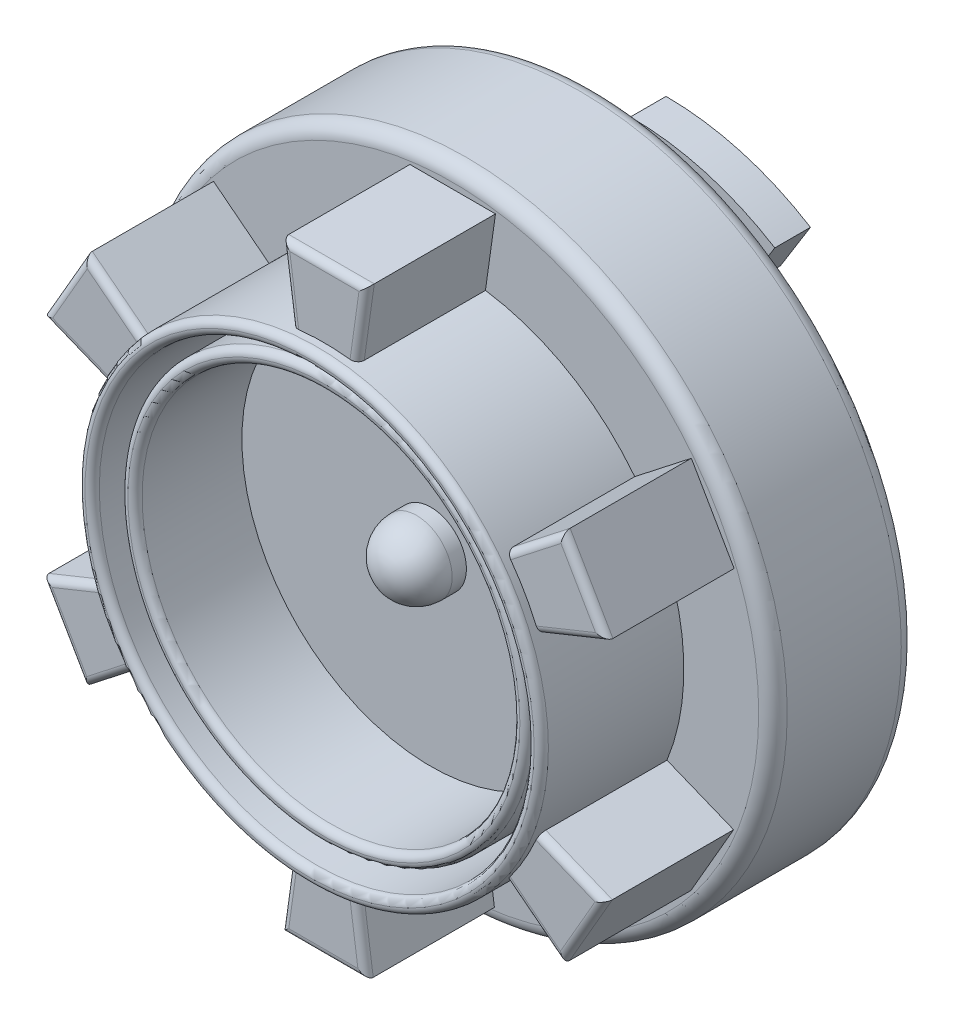
from build123d import *

# Parameters (mm, degrees)
SKETCH1_R           = 41.275
BOSS_EXTRUDE1_DEPTH = 25.4
SKETCH2_R           = 36.068
CUT_EXTRUDE1_DEPTH  = 25.4
SKETCH3_R           = 57.15
BOSS_EXTRUDE2_DEPTH = 25.4
SKETCH4_R           = 29.21
CUT_EXTRUDE2_DEPTH  = 96.461432003
CUT_EXTRUDE4_DEPTH  = 22.86
CUT_EXTRUDE5_DEPTH  = 20.32
BOSS_EXTRUDE3_DEPTH = 6.35
BOSS_EXTRUDE4_DEPTH = 6.35
BOSS_EXTRUDE5_DEPTH = 6.35
BOSS_EXTRUDE6_DEPTH = 6.35
CUT_EXTRUDE6_DEPTH  = 22.86
CUT_EXTRUDE7_DEPTH  = 20.32
SKETCH15_R          = 34.29
SKETCH15_R_2        = 30.48
CUT_EXTRUDE8_DEPTH  = 12.7
FILLET1_R           = 2.54
BOSS_EXTRUDE7_START = -25.4
SKETCH16_R          = 41.275
BOSS_EXTRUDE7_DEPTH = 25.4
SKETCH17_R          = 38.735
SKETCH17_R_2        = 36.195
CUT_EXTRUDE9_DEPTH  = 25.4
SKETCH18_R          = 33.655
SKETCH18_R_2        = 6.35
CUT_EXTRUDE10_DEPTH = 21.59
SKETCH19_R          = 6.35
CUT_EXTRUDE11_DEPTH = 12.7
SKETCH20_R          = 36.195
SKETCH20_R_2        = 33.655
CUT_EXTRUDE12_DEPTH = 2.54
FILLET2_R           = 6.35
FILLET3_R           = 1.27
FILLET4_R           = 1.27
BOSS_EXTRUDE8_DEPTH = 22.86
FILLET5_R           = 1.27
FILLET6_R           = 2.54


with BuildPart() as part:
    # Sketch1 → Boss-Extrude1 (new body)
    with BuildSketch(Plane.XY):
        Circle(SKETCH1_R)
    extrude(amount=BOSS_EXTRUDE1_DEPTH)

    # Sketch2 → Cut-Extrude1 (cut)
    with BuildSketch(Plane.XY.offset(25.4)):
        Circle(SKETCH2_R)
    extrude(amount=-CUT_EXTRUDE1_DEPTH, mode=Mode.SUBTRACT)

    # Sketch3 → Boss-Extrude2 (add)
    with BuildSketch(Plane(origin=(0, 0, 0), x_dir=(-1, 0, 0), z_dir=(0, 0, -1))):
        Circle(SKETCH3_R)
    extrude(amount=BOSS_EXTRUDE2_DEPTH)

    # Sketch4 → Cut-Extrude2 (cut, through all)
    with BuildSketch(Plane(origin=(0, 0, -25.4), x_dir=(-1, 0, 0), z_dir=(0, 0, -1))):
        Circle(SKETCH4_R)
    extrude(amount=-CUT_EXTRUDE2_DEPTH, mode=Mode.SUBTRACT)

    # Sketch6 → Cut-Extrude4 (cut)
    with BuildSketch(Plane(origin=(0, 0, -25.4), x_dir=(-1, 0, 0), z_dir=(0, 0, -1))):
        with BuildLine():
            Line((18.506279238, -30.364967129), (24.454726136, -40.125135135))
            ThreePointArc((24.454726136, -40.125135135), (46.842589674, -3.719125253), (30.48, 35.763524714))
            ThreePointArc((30.48, 35.763524714), (28.349648711, 38.283083694), (27.139008157, 41.35243599))
            ThreePointArc((27.139008157, 41.35243599), (26.51640571, 42.835799248), (25.4, 43.994090512))
            ThreePointArc((25.4, 43.994090512), (13.148007491, 49.069031975), (0, 50.8))
            Line((0, 50.8), (0, 35.56))
            ThreePointArc((0, 35.56), (34.23661659, 9.610810811), (18.506279238, -30.364967129))
        make_face()
    extrude(amount=-CUT_EXTRUDE4_DEPTH, mode=Mode.SUBTRACT)

    # Sketch8 → Cut-Extrude5 (cut)
    with BuildSketch(Plane(origin=(0, 0, -22.86), x_dir=(-1, 0, 0), z_dir=(0, 0, -1))):
        with BuildLine():
            Line((26.437541769, -43.37852447), (24.454726136, -40.125135135))
            ThreePointArc((24.454726136, -40.125135135), (46.842589674, -3.719125253), (30.48, 35.763524714))
            ThreePointArc((30.48, 35.763524714), (28.349648711, 38.283083694), (27.139008157, 41.35243599))
            ThreePointArc((27.139008157, 41.35243599), (26.51640571, 42.835799248), (25.4, 43.994090512))
            ThreePointArc((25.4, 43.994090512), (50.796418637, 0.6032028), (26.437541769, -43.37852447))
        make_face()
    extrude(amount=-CUT_EXTRUDE5_DEPTH, mode=Mode.SUBTRACT)

    # Sketch9 → Boss-Extrude3 (add)
    with BuildSketch(Plane(origin=(0, 0, -25.4), x_dir=(-1, 0, 0), z_dir=(0, 0, -1))):
        with BuildLine():
            Line((0, 44.45), (0, 38.608))
            ThreePointArc((0, 38.608), (-10.589622857, 37.127315439), (-20.36698447, 32.798835461))
            Line((-20.36698447, 32.798835461), (-23.448830804, 37.761817143))
            ThreePointArc((-23.448830804, 37.761817143), (-12.192, 42.745264486), (0, 44.45))
        make_face()
    extrude(amount=BOSS_EXTRUDE3_DEPTH)

    # Sketch10 → Boss-Extrude4 (add)
    with BuildSketch(Plane(origin=(0, 0, -31.75), x_dir=(-1, 0, 0), z_dir=(0, 0, -1))):
        with BuildLine():
            Line((-20.36698447, 32.798835461), (-25.726717225, 41.430107951))
            ThreePointArc((-25.726717225, 41.430107951), (-13.376365714, 46.897661608), (0, 48.768))
            Line((0, 48.768), (0, 38.608))
            ThreePointArc((0, 38.608), (-10.589622857, 37.127315439), (-20.36698447, 32.798835461))
        make_face()
    extrude(amount=BOSS_EXTRUDE4_DEPTH)

    # Sketch11 → Boss-Extrude5 (add)
    with BuildSketch(Plane(origin=(0, 0, -25.4), x_dir=(-1, 0, 0), z_dir=(0, 0, -1))):
        with BuildLine():
            Line((0, -46.228), (0, -38.608))
            ThreePointArc((0, -38.608), (10.434594595, -37.171183727), (20.092531744, -32.967678598))
            Line((20.092531744, -32.967678598), (24.058163009, -39.474457268))
            ThreePointArc((24.058163009, -39.474457268), (12.494054054, -44.507601568), (0, -46.228))
        make_face()
    extrude(amount=BOSS_EXTRUDE5_DEPTH)

    # Sketch12 → Boss-Extrude6 (add)
    with BuildSketch(Plane(origin=(0, 0, -31.75), x_dir=(-1, 0, 0), z_dir=(0, 0, -1))):
        with BuildLine():
            Line((0, -38.608), (0, -48.768))
            ThreePointArc((0, -48.768), (13.180540541, -46.953074181), (25.380040098, -41.643383492))
            Line((25.380040098, -41.643383492), (20.092531744, -32.967678598))
            ThreePointArc((20.092531744, -32.967678598), (10.434594595, -37.171183727), (0, -38.608))
        make_face()
    extrude(amount=BOSS_EXTRUDE6_DEPTH)

    # Sketch13 → Cut-Extrude6 (cut)
    with BuildSketch(Plane(origin=(0, 0, -25.4), x_dir=(-1, 0, 0), z_dir=(0, 0, -1))):
        with BuildLine():
            Line((0, -35.56), (0, -50.8))
            ThreePointArc((0, -50.8), (-13.148007491, -49.069031975), (-25.4, -43.994090512))
            ThreePointArc((-25.4, -43.994090512), (-27.380071612, -41.913162133), (-27.914964156, -39.090957945))
            ThreePointArc((-27.914964156, -39.090957945), (-29.023609665, -37.293207394), (-30.48, -35.763524714))
            ThreePointArc((-30.48, -35.763524714), (-46.857702082, 3.52361399), (-24.788763993, 39.919635265))
            Line((-24.788763993, 39.919635265), (-18.759064643, 30.209453714))
            ThreePointArc((-18.759064643, 30.209453714), (-34.196211589, -9.7536), (0, -35.56))
        make_face()
    extrude(amount=-CUT_EXTRUDE6_DEPTH, mode=Mode.SUBTRACT)

    # Sketch14 → Cut-Extrude7 (cut)
    with BuildSketch(Plane(origin=(0, 0, -22.86), x_dir=(-1, 0, 0), z_dir=(0, 0, -1))):
        with BuildLine():
            Line((-26.798663776, 43.156362449), (-24.788763993, 39.919635265))
            ThreePointArc((-24.788763993, 39.919635265), (-46.857702082, 3.52361399), (-30.48, -35.763524714))
            ThreePointArc((-30.48, -35.763524714), (-29.023609665, -37.293207394), (-27.914964156, -39.090957945))
            ThreePointArc((-27.914964156, -39.090957945), (-27.380071612, -41.913162133), (-25.4, -43.994090512))
            ThreePointArc((-25.4, -43.994090512), (-50.793459105, -0.815176157), (-26.798663776, 43.156362449))
        make_face()
    extrude(amount=-CUT_EXTRUDE7_DEPTH, mode=Mode.SUBTRACT)

    # Sketch15 → Cut-Extrude8 (cut)
    with BuildSketch(Plane(origin=(0, 0, -25.4), x_dir=(-1, 0, 0), z_dir=(0, 0, -1))):
        Circle(SKETCH15_R)
        Circle(SKETCH15_R_2, mode=Mode.SUBTRACT)
    extrude(amount=-CUT_EXTRUDE8_DEPTH, mode=Mode.SUBTRACT)

    # Fillet1
    fillet1_edges = [part.edges().sort_by_distance(p)[0] for p in [
        (57.15, 0, -25.4),
    ]]
    fillet(fillet1_edges, radius=FILLET1_R)

    # Sketch16 → Boss-Extrude7 (add)
    with BuildSketch(Plane.XY.offset(25.4).offset(BOSS_EXTRUDE7_START)):
        Circle(SKETCH16_R)
    extrude(amount=BOSS_EXTRUDE7_DEPTH)

    # Sketch17 → Cut-Extrude9 (cut)
    with BuildSketch(Plane.XY.offset(25.4)):
        Circle(SKETCH17_R)
        Circle(SKETCH17_R_2, mode=Mode.SUBTRACT)
    extrude(amount=-CUT_EXTRUDE9_DEPTH, mode=Mode.SUBTRACT)

    # Sketch18 → Cut-Extrude10 (cut)
    with BuildSketch(Plane.XY.offset(25.4)):
        Circle(SKETCH18_R)
        Circle(SKETCH18_R_2, mode=Mode.SUBTRACT)
    extrude(amount=-CUT_EXTRUDE10_DEPTH, mode=Mode.SUBTRACT)

    # Sketch19 → Cut-Extrude11 (cut)
    with BuildSketch(Plane.XY.offset(25.4)):
        Circle(SKETCH19_R)
    extrude(amount=-CUT_EXTRUDE11_DEPTH, mode=Mode.SUBTRACT)

    # Sketch20 → Cut-Extrude12 (cut)
    with BuildSketch(Plane.XY.offset(25.4)):
        Circle(SKETCH20_R)
        Circle(SKETCH20_R_2, mode=Mode.SUBTRACT)
    extrude(amount=-CUT_EXTRUDE12_DEPTH, mode=Mode.SUBTRACT)

    # Fillet2
    fillet2_edges = [part.edges().sort_by_distance(p)[0] for p in [
        (-6.35, 0, 12.7),
    ]]
    fillet(fillet2_edges, radius=FILLET2_R)

    # Fillet3
    fillet3_edges = [part.edges().sort_by_distance(p)[0] for p in [
        (-36.195, 0, 22.86),
        (-33.655, 0, 22.86),
    ]]
    fillet(fillet3_edges, radius=FILLET3_R - 0.0001)  # a hair under: the kernel refuses the full size

    # Fillet4
    fillet4_edges = [part.edges().sort_by_distance(p)[0] for p in [
        (-38.735, 0, 25.4),
        (-41.275, 0, 25.4),
    ]]
    fillet(fillet4_edges, radius=FILLET4_R - 0.0001)  # a hair under: the kernel refuses the full size

    # Sketch21 → Boss-Extrude8 (add)
    with BuildSketch(Plane.XY):
        with BuildLine():
            Line((-5.744369742, 40.873314537), (-7.525519288, 53.546852084))
            Line((-7.525519288, 53.546852084), (7.714480712, 53.546852084))
            Line((7.714480712, 53.546852084), (5.929612112, 40.846852084))
            ThreePointArc((5.929612112, 40.846852084), (0.093561473, 41.274893958), (-5.744369742, 40.873314537))
        make_face()
        with BuildLine():
            Line((42.610174554, 33.290716922), (50.230174554, 20.092489768))
            Line((50.230174554, 20.092489768), (38.339217626, 15.288231319))
            ThreePointArc((38.339217626, 15.288231319), (35.791887443, 20.556420367), (32.525143855, 25.411427394))
            Line((32.525143855, 25.411427394), (42.610174554, 33.290716922))
        make_face()
        with BuildLine():
            Line((50.135693842, -20.256135162), (42.515693842, -33.454362316))
            Line((42.515693842, -33.454362316), (32.409605514, -25.558620765))
            ThreePointArc((32.409605514, -25.558620765), (35.69832597, -20.718473591), (38.269513597, -15.461887143))
            Line((38.269513597, -15.461887143), (50.135693842, -20.256135162))
        make_face()
        with BuildLine():
            Line((7.525519288, -53.546852084), (-7.714480712, -53.546852084))
            Line((-7.714480712, -53.546852084), (-5.929612112, -40.846852084))
            ThreePointArc((-5.929612112, -40.846852084), (-0.093561473, -41.274893958), (5.744369742, -40.873314537))
            Line((5.744369742, -40.873314537), (7.525519288, -53.546852084))
        make_face()
        with BuildLine():
            Line((-42.610174554, -33.290716922), (-50.230174554, -20.092489768))
            Line((-50.230174554, -20.092489768), (-38.339217626, -15.288231319))
            ThreePointArc((-38.339217626, -15.288231319), (-35.791887443, -20.556420367), (-32.525143855, -25.411427394))
            Line((-32.525143855, -25.411427394), (-42.610174554, -33.290716922))
        make_face()
        with BuildLine():
            Line((-50.135693842, 20.256135162), (-42.515693842, 33.454362316))
            Line((-42.515693842, 33.454362316), (-32.409605514, 25.558620765))
            ThreePointArc((-32.409605514, 25.558620765), (-35.69832597, 20.718473591), (-38.269513597, 15.461887143))
            Line((-38.269513597, 15.461887143), (-50.135693842, 20.256135162))
        make_face()
    extrude(amount=BOSS_EXTRUDE8_DEPTH)

    # Fillet5
    fillet5_edges = [part.edges().sort_by_distance(p)[0] for p in [
        (6.822046412, 47.196852084, 22.86),
        (0.094480712, 53.546852084, 22.86),
        (-6.634944515, 47.210083311, 22.86),
        (44.28469609, 17.690360544, 22.86),
        (46.420174554, 26.691603345, 22.86),
        (37.567659205, 29.351072158, 22.86),
        (37.462649678, -29.506491541, 22.86),
        (46.325693842, -26.855248739, 22.86),
        (44.202603719, -17.859011153, 22.86),
        (-6.822046412, -47.196852084, 22.86),
        (-0.094480712, -53.546852084, 22.86),
        (6.634944515, -47.210083311, 22.86),
        (-44.28469609, -17.690360544, 22.86),
        (-46.420174554, -26.691603345, 22.86),
        (-37.567659205, -29.351072158, 22.86),
        (-37.462649678, 29.506491541, 22.86),
        (-46.325693842, 26.855248739, 22.86),
        (-44.202603719, 17.859011153, 22.86),
    ]]
    fillet(fillet5_edges, radius=FILLET5_R)

    # Fillet6
    fillet6_edges = [part.edges().sort_by_distance(p)[0] for p in [
        (57.15, 0, 0),
    ]]
    fillet(fillet6_edges, radius=FILLET6_R)


solid = part.part
